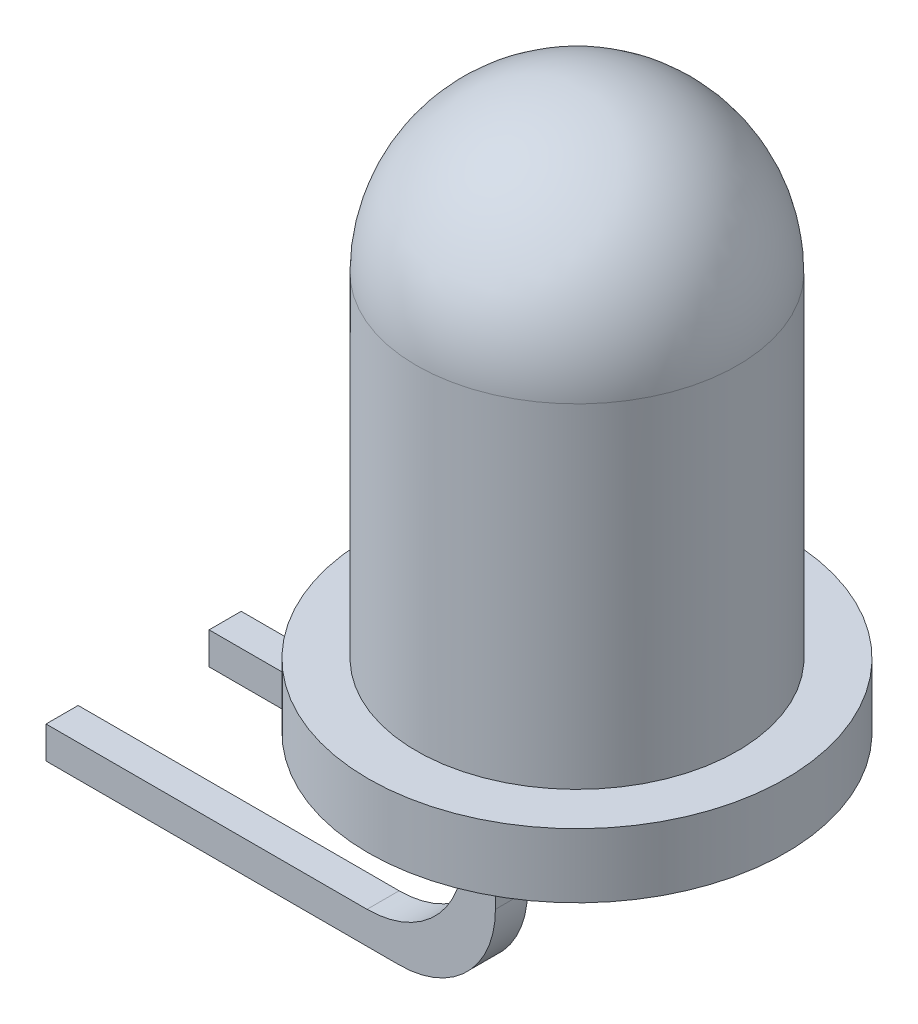
from build123d import *

# Parameters (mm, degrees)
EXTRUDE_1_DEPTH         = 1.52
CUT_EXTRUDE_START       = -3
CUT_EXTRUDE_1_OUTLINE_W = 7
CUT_EXTRUDE_1_OUTLINE_H = 2.04
CUT_EXTRUDE_1_DEPTH     = 3


# Read off the part's stored shape, not the designer's step: Вырез-Вытянуть1
with BuildPart() as part:
    # Эскиз1 → Повернуть1 (revolve)
    with BuildSketch(Plane(origin=(0, 0, 0), x_dir=(0, 0, -1), z_dir=(1, 0, 0)), mode=Mode.PRIVATE) as revolve_1_sk:
        with BuildLine():
            Line((-2.5, 1), (0, 1))
            Line((0, 1), (0, 8.7))
            ThreePointArc((0, 8.7), (-1.767766953, 7.967766953), (-2.5, 6.2))
            Line((-2.5, 6.2), (-2.5, 1))
        make_face()
        Polygon((-3.25, 1), (-3.25, 0), (0, 0), (0, 1), (-2.5, 1), align=None)
    revolve(revolve_1_sk.sketch.rotate(Axis((0, -2.603301624, 0), (0, 1, 0)), 180), axis=Axis((0, -2.603301624, 0), (0, 1, 0)))

    # Эскиз2 → Бобышка-Вытянуть1 (add, symmetric)
    with BuildSketch(Plane.XY):
        with BuildLine():
            Line((0.25, 0), (0.25, -1.5))
            ThreePointArc((0.25, -1.5), (-0.189339828, -2.560660172), (-1.25, -3))
            Line((-1.25, -3), (-6.75, -3))
            Line((-6.75, -3), (-6.75, -2.5))
            Line((-6.75, -2.5), (-1.75, -2.5))
            ThreePointArc((-1.75, -2.5), (-0.689339828, -2.060660172), (-0.25, -1))
            Line((-0.25, -1), (-0.25, 0))
            Line((-0.25, 0), (0.25, 0))
        make_face()
    extrude(amount=EXTRUDE_1_DEPTH, both=True)

    # Вырез-Вытянуть1 outline → Вырез-Вытянуть1 (cut)
    with BuildSketch(Plane.XZ.offset(3).offset(CUT_EXTRUDE_START)):
        with Locations((-3.25, 0)):
            Rectangle(CUT_EXTRUDE_1_OUTLINE_W, CUT_EXTRUDE_1_OUTLINE_H)
    extrude(amount=CUT_EXTRUDE_1_DEPTH, mode=Mode.SUBTRACT)


solid = part.part
